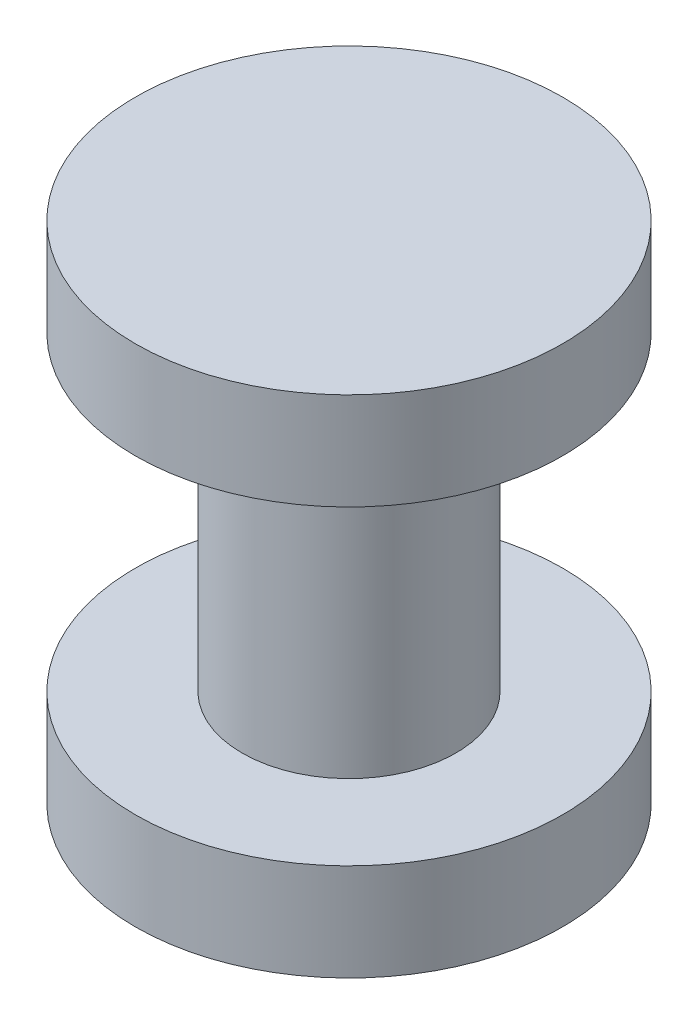
from build123d import *

# Parameters (mm, degrees)
SKETCH_1_R          = 11
EXTRUDE_3_DEPTH     = 13
SKETCH_1_10_R       = 11
SKETCH_1_10_R_2     = 5.5
CUT_EXTRUDE_1_DEPTH = 8


with BuildPart() as part:
    # 草图1 → 凸台-拉伸3 (new, symmetric)
    with BuildSketch(Plane(origin=(0, 0, 0), x_dir=(1, 0, 0), z_dir=(0, 1, 0))):
        Circle(SKETCH_1_R)
    extrude(amount=EXTRUDE_3_DEPTH, both=True)

    # 草图1<10> → 切除-拉伸1 (cut, symmetric)
    with BuildSketch(Plane(origin=(0, 0, 0), x_dir=(1, 0, 0), z_dir=(0, 1, 0))):
        Circle(SKETCH_1_10_R)
        Circle(SKETCH_1_10_R_2, mode=Mode.SUBTRACT)
    extrude(amount=CUT_EXTRUDE_1_DEPTH, both=True, mode=Mode.SUBTRACT)


solid = part.part
